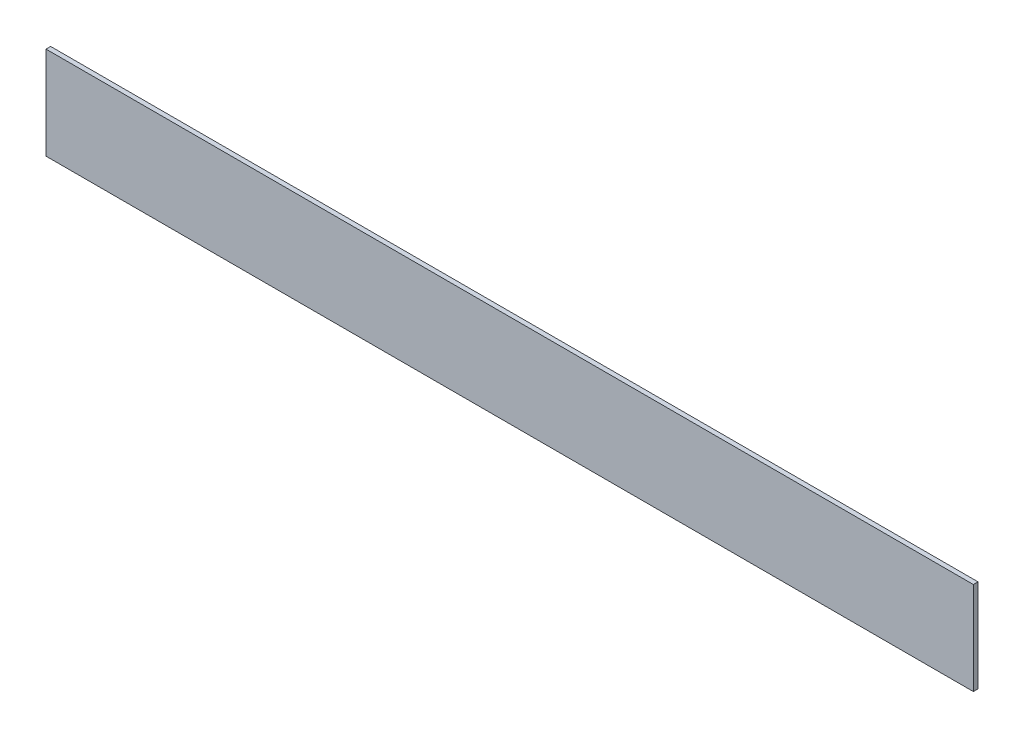
from build123d import *

# Parameters (mm, degrees)
IZIM1_W            = 1000
IZIM1_H            = 100
TABAN_FLAN_1_DEPTH = 5


# Sheet-metal steps are written as plain solids
with BuildPart() as part:
    # Çizim1 → Taban-Flanş1 (new body)
    with BuildSketch(Plane.XY):
        with Locations((500, -50)):
            Rectangle(IZIM1_W, IZIM1_H)
    extrude(amount=-TABAN_FLAN_1_DEPTH)


solid = part.part
